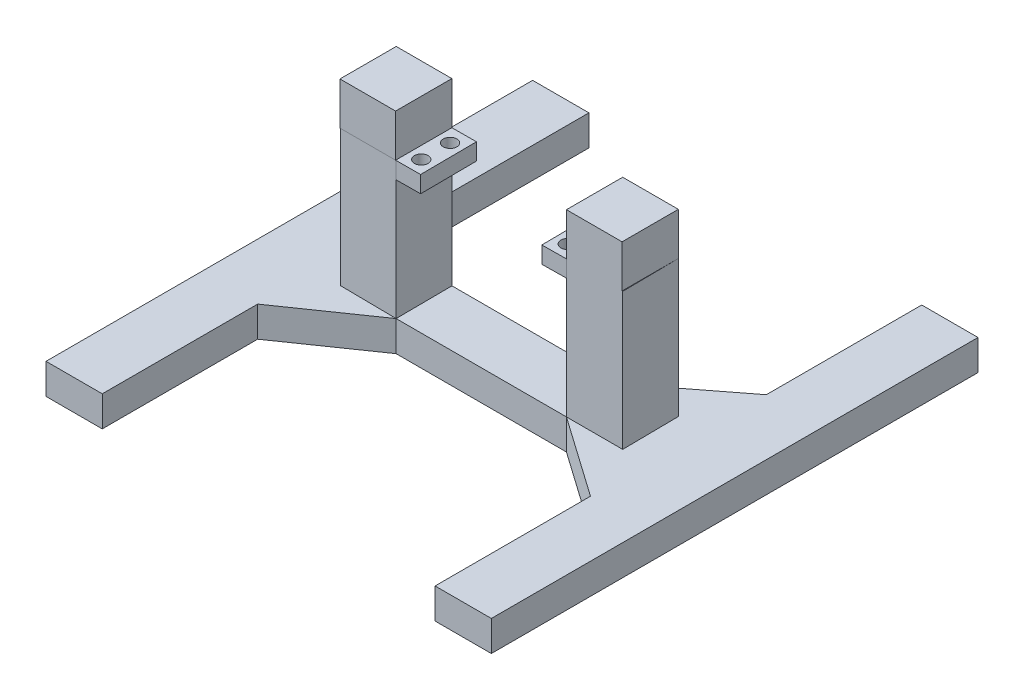
from build123d import *

# Parameters (mm, degrees)
BOSS_EXTRUDE1_DEPTH     = 10
BOSS_EXTRUDE1_2_DEPTH   = 10
BOSS_EXTRUDE1_3_DEPTH   = 10
BOSS_EXTRUDE5_DEPTH     = 55
SKETCH5_W               = 18.5
SKETCH5_H               = 5.5
BOSS_EXTRUDE6_DEPTH     = 8
SKETCH6_W               = 18.5
SKETCH6_H               = 5.5
BOSS_EXTRUDE7_DEPTH     = 8
BOSS_EXTRUDE8_OUTLINE_W = 18.287900599
BOSS_EXTRUDE8_OUTLINE_H = 18.500510452
BOSS_EXTRUDE8_DEPTH     = 14
SKETCH7_3_R             = 2.25
CUT_EXTRUDE1_DEPTH      = 10


# Read off the part's stored shape, not the designer's step: Boss-Extrude8
with BuildPart() as part:
    # Sketch1 → Boss-Extrude1 (new body)
    with BuildSketch(Plane(origin=(0, 0, 0), x_dir=(1, 0, 0), z_dir=(0, 1, 0))):
        Polygon((-54.711603102, -80), (-54.711603102, -28.907893648), (-27.826820773, -10.273471277), (-46.326820773, -10.048678982), (-46.460237213, 8.450839932), (-27.961603102, 8.226037736), (-54.711603102, 28.907893648), (-54.711603102, 80), (-73.211603102, 80), (-73.211603102, -80), align=None)
    extrude(amount=BOSS_EXTRUDE1_DEPTH)



with BuildPart() as body_2:
    # Sketch1 → Boss-Extrude1 2 (new body)
    with BuildSketch(Plane(origin=(0, 0, 0), x_dir=(1, 0, 0), z_dir=(0, 1, 0))):
        Polygon((-27.961603102, 8.226037736), (-27.826820773, -10.273471277), (28.173179227, -10.273471277), (27.961603102, 8.225318833), align=None)
    extrude(amount=BOSS_EXTRUDE1_2_DEPTH)


with BuildPart() as body_3:
    # Sketch1 → Boss-Extrude1 3 (new body)
    with BuildSketch(Plane(origin=(0, 0, 0), x_dir=(1, 0, 0), z_dir=(0, 1, 0))):
        Polygon((46.674397065, -10.272954842), (28.173179227, -10.273471277), (54.711603102, -28.907893648), (54.711603102, -80), (73.211603102, -80), (73.211603102, 80), (54.711603102, 80), (54.711603102, 28.907893648), (27.961603102, 8.225318833), (46.461603021, 8.227045158), align=None)
    extrude(amount=BOSS_EXTRUDE1_3_DEPTH)


with BuildPart() as part_1:
    add(part.part)

    add(body_2.part)  # Boss-Extrude5 merges body 2

    add(body_3.part)  # Boss-Extrude5 merges body 3
    # Sketch1<9> → Boss-Extrude5 (add)
    with BuildSketch(Plane(origin=(0, 0, 0), x_dir=(1, 0, 0), z_dir=(0, 1, 0))):
        Polygon((46.461603021, 8.227045158), (46.674397065, -10.272954842), (28.173179227, -10.273471277), (27.961603102, 8.225318833), align=None)
        Polygon((-27.961603102, 8.226037736), (-46.460237213, 8.450839932), (-46.326820773, -10.048678982), (-27.826820773, -10.273471277), align=None)
    extrude(amount=BOSS_EXTRUDE5_DEPTH)

    # Sketch5 → Boss-Extrude6 (add)
    with BuildSketch(Plane(origin=(28.052008971, 0, -0.32083911), x_dir=(0.011436547294728296, 0, 0.999934600554444), z_dir=(-0.999934600554444, 0, 0.011436547294728296))):
        with Locations((1.345003295, 52.25)):
            Rectangle(SKETCH5_W, SKETCH5_H)
    extrude(amount=BOSS_EXTRUDE6_DEPTH)

    # Sketch6 → Boss-Extrude7 (add)
    with BuildSketch(Plane(origin=(-27.900189464, 0, 0.203273098), x_dir=(-0.007285531290396893, 0, -0.9999734601647269), z_dir=(0.9999734601647269, 0, -0.007285531290396893))):
        with Locations((-0.820465448, 52.25)):
            Rectangle(SKETCH6_W, SKETCH6_H)
    extrude(amount=BOSS_EXTRUDE7_DEPTH)

    # Boss-Extrude8 outline → Boss-Extrude8 (add)
    with BuildSketch(Plane(origin=(0, 55, 0), x_dir=(1, 0, 0), z_dir=(0, 1, 0))):
        with Locations((-37.144162619, -1.023210068)):
            Rectangle(BOSS_EXTRUDE8_OUTLINE_W, BOSS_EXTRUDE8_OUTLINE_H)
        Polygon((46.461603021, -10.272960782), (46.461603021, 8.227045158), (28.173702422, 8.225338625), (28.173702422, -10.273471263), align=None)
    extrude(amount=BOSS_EXTRUDE8_DEPTH)

    # Sketch7<3> → Cut-Extrude1 (cut, symmetric)
    with BuildSketch(Plane(origin=(0, 55, 0), x_dir=(1, 0, 0), z_dir=(0, 1, 0))):
        with Locations(Location((24.147255407, 3.611254336, 0), (0, 0, 270))):
            Circle(SKETCH7_3_R)
        with Locations(Location((24.147255407, -5.842391538, 0), (0, 0, 270))):
            Circle(SKETCH7_3_R)
        with Locations(Location((-23.973765303, -5.842391538, 0), (0, 0, 270))):
            Circle(SKETCH7_3_R)
        with Locations(Location((-23.973765303, 3.611254336, 0), (0, 0, 270))):
            Circle(SKETCH7_3_R)
    extrude(amount=CUT_EXTRUDE1_DEPTH, both=True, mode=Mode.SUBTRACT)


solid = part_1.part
